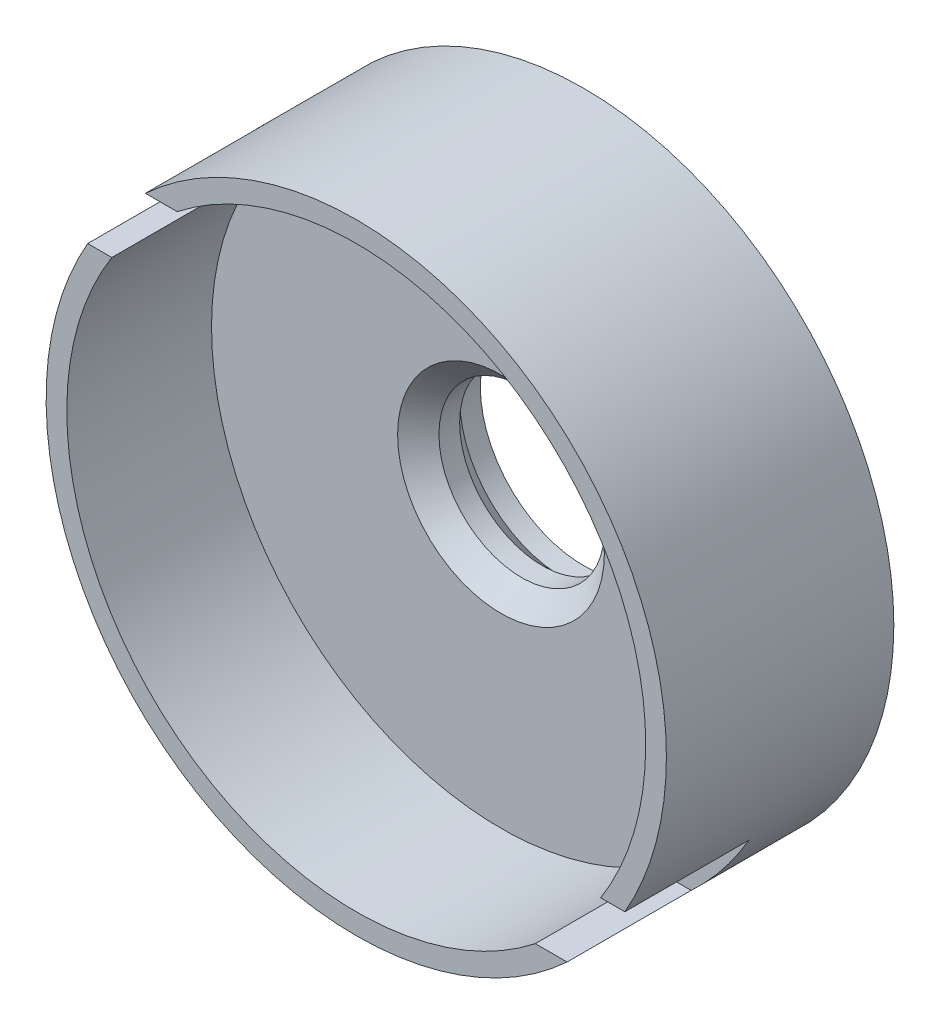
from build123d import *

# Parameters (mm, degrees)
EXTRUDE_1_DEPTH          = 20
EXTRUDE_1_DEPTH_BACK     = 2
SKETCH_5_R               = 30
CUT_EXTRUDE_START        = 6
SKETCH_6_R               = 28
CUT_EXTRUDE_1_DEPTH      = 14
CUT_EXTRUDE_2_DEPTH      = 15
CUT_EXTRUDE_2_DEPTH_BACK = 2
SKETCH_7_R               = 8
CUT_EXTRUDE_START_2      = 8
SKETCH_10_W              = 15
SKETCH_10_H              = 7
CUT_EXTRUDE_4_DEPTH      = 12
SKETCH_13_W              = 15
SKETCH_13_H              = 7
CUT_EXTRUDE_5_DEPTH      = 12


with BuildPart() as part:
    # Эскиз5 → Бобышка-Вытянуть1 (new, two sides: drawn at the far end of the back side and taken through both)
    with BuildSketch(Plane.XY.offset(-EXTRUDE_1_DEPTH_BACK)):
        Circle(SKETCH_5_R)
    extrude(amount=EXTRUDE_1_DEPTH + EXTRUDE_1_DEPTH_BACK)

    # Эскиз6 → Вырез-Вытянуть1 (cut)
    with BuildSketch(Plane.XY.offset(CUT_EXTRUDE_START)):
        Circle(SKETCH_6_R)
    extrude(amount=CUT_EXTRUDE_1_DEPTH, mode=Mode.SUBTRACT)

    # Эскиз7 → Вырез-Вытянуть2 (cut, two sides: drawn at the far end of the back side and taken through both)
    with BuildSketch(Plane.XY.offset(-CUT_EXTRUDE_2_DEPTH_BACK)):
        Circle(SKETCH_7_R)
    extrude(amount=CUT_EXTRUDE_2_DEPTH + CUT_EXTRUDE_2_DEPTH_BACK, mode=Mode.SUBTRACT)

    # Эскиз10 → Вырез-Вытянуть4 (cut)
    with BuildSketch(Plane.XY.offset(CUT_EXTRUDE_START_2)):
        with Locations((-22.5, 18.5)):
            Rectangle(SKETCH_10_W, SKETCH_10_H)
    extrude(amount=CUT_EXTRUDE_4_DEPTH, mode=Mode.SUBTRACT)

    # Эскиз13 → Вырез-Вытянуть5 (cut)
    with BuildSketch(Plane.XY.offset(CUT_EXTRUDE_START_2)):
        with Locations((22.5, -18.5)):
            Rectangle(SKETCH_13_W, SKETCH_13_H)
    extrude(amount=CUT_EXTRUDE_5_DEPTH, mode=Mode.SUBTRACT)

    # Эскиз15 → Вырез-Повернуть1 (revolve, cut)
    with BuildSketch(Plane(origin=(0, 0, 0), x_dir=(0, 0, -1), z_dir=(1, 0, 0))):
        Polygon((-6, 8), (-4, 8), (-6, 10), align=None)
        Polygon((2, 8), (2, 10), (0, 10), (-2, 8), align=None)
    revolve(axis=Axis((0, 0, 0), (0, 0, 1)), mode=Mode.SUBTRACT)


solid = part.part
